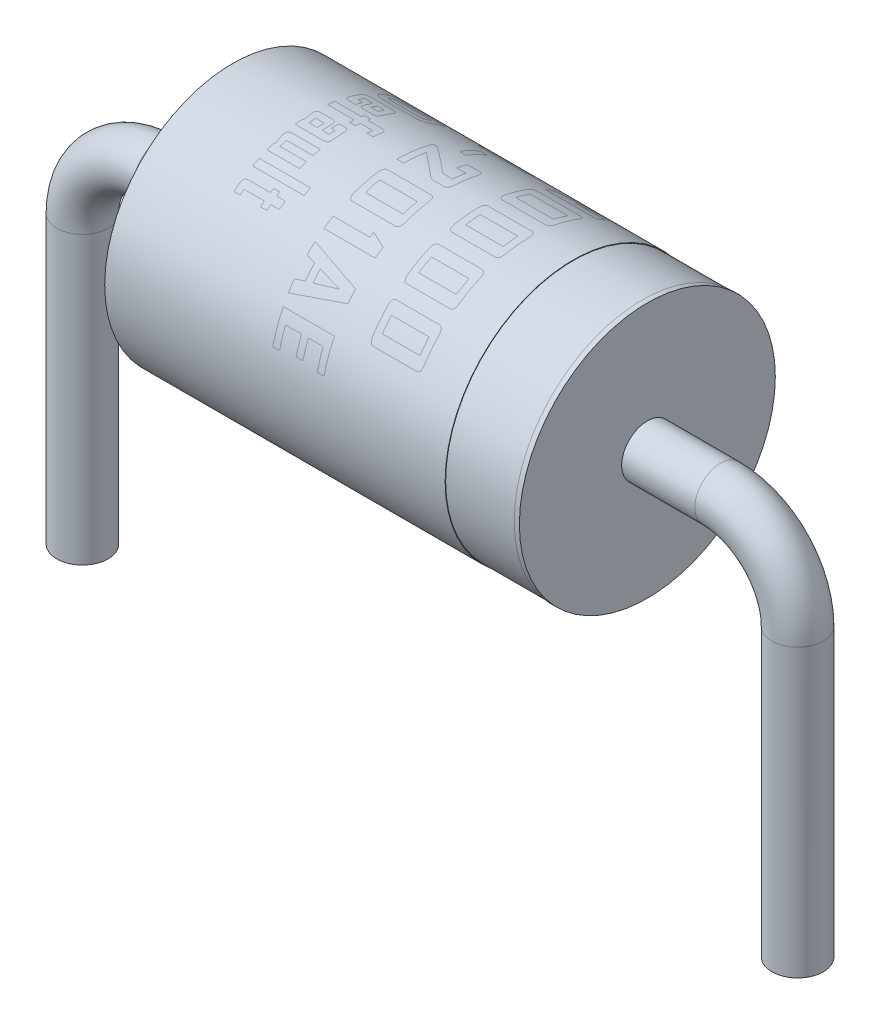
from build123d import *

# Parameters (mm, degrees)
SKETCH1_R     = 2.5
BODY_DEPTH    = 4.05
CATHODE_START = 0.1
SKETCH8_R     = 2.51
SKETCH8_R_2   = 2.49
CATHODE_DEPTH = 1.35
SKETCH6_R     = 0.50175


with BuildPart() as part:
    # Sketch1 → BODY (new, symmetric)
    with BuildSketch(Plane(origin=(6.985, 0, 0), x_dir=(0, 0, -1), z_dir=(1, 0, 0))):
        with Locations((0, 4.5)):
            Circle(SKETCH1_R)
    extrude(amount=BODY_DEPTH, both=True)

    # Sketch8 → CATHODE (cut)
    with BuildSketch(Plane.ZY.offset(-11.035).offset(CATHODE_START)):
        with Locations((0, 4.5)):
            Circle(SKETCH8_R)
        with Locations((0, 4.5)):
            Circle(SKETCH8_R_2, mode=Mode.SUBTRACT)
    extrude(amount=CATHODE_DEPTH, mode=Mode.SUBTRACT)

    # PINS: sweep along a path in Sketch7
    with BuildLine(Plane.XY) as pins_path:
        Line((0, -2.6), (0, 2.99475))
        ThreePointArc((0, 2.99475), (0.440877518, 4.059122482), (1.50525, 4.5))
        Line((1.50525, 4.5), (12.46475, 4.5))
        ThreePointArc((12.46475, 4.5), (13.529122482, 4.059122482), (13.97, 2.99475))
        Line((13.97, 2.99475), (13.97, -2.6))
    # Sketch6 → PINS (sweep)
    with BuildSketch(Plane(origin=(6.985, 0, 0), x_dir=(0, 0, -1), z_dir=(1, 0, 0))):
        with Locations((0, 4.5)):
            Circle(SKETCH6_R)
    sweep(path=pins_path.line)


solid = part.part
